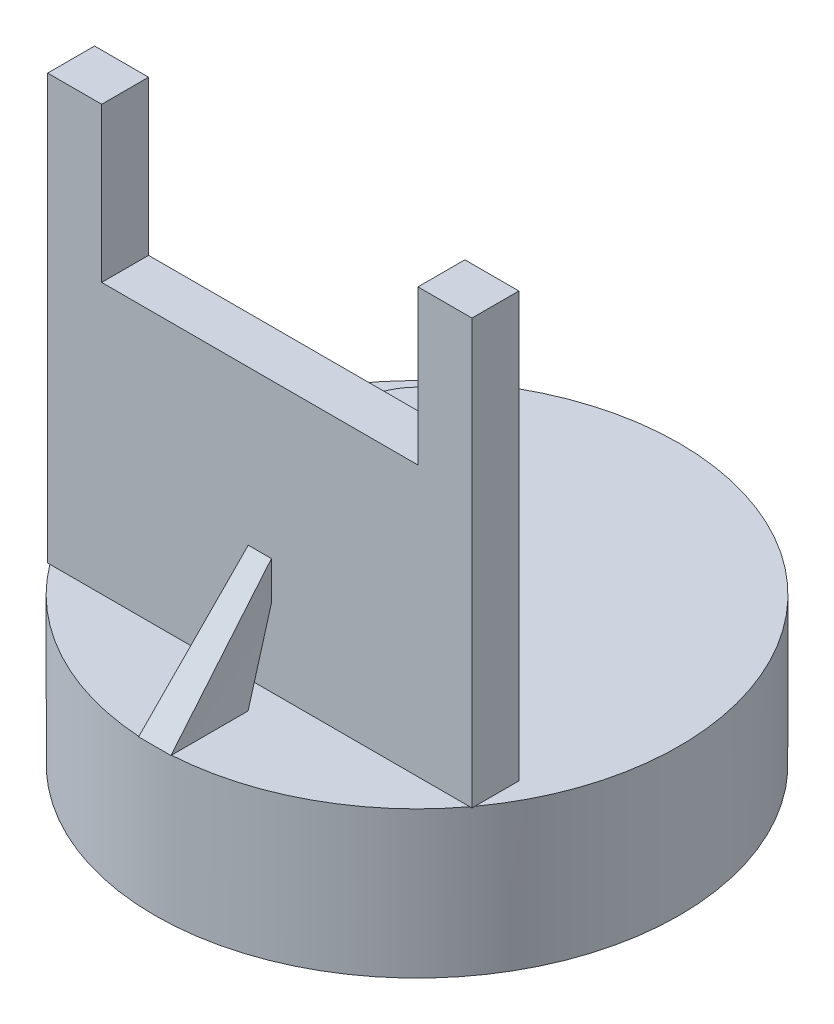
from build123d import *

# Parameters (mm, degrees)
SKETCH10_R              = 7.5
SKETCH10_R_2            = 4.5
BOSS_EXTRUDE2_DEPTH     = 8
CUT_EXTRUDE2_DEPTH      = 19
CUT_EXTRUDE2_DEPTH_BACK = 12
SKETCH11_W              = 4
SKETCH11_H              = 2
SKETCH13_R              = 7.5
SKETCH13_R_2            = 2.5
BOSS_EXTRUDE3_DEPTH     = 10
SKETCH15_W              = 55
SKETCH15_H              = 6.077899871
BOSS_EXTRUDE4_DEPTH     = 35
SKETCH16_W              = 7
SKETCH16_H              = 6.077899871
BOSS_EXTRUDE5_DEPTH     = 20


with BuildPart() as part:
    # Sketch2 → Revolve1 (revolve)
    with BuildSketch(Plane(origin=(0, 0, 0), x_dir=(0, 0, -1), z_dir=(1, 0, 0))):
        Polygon((31, 0), (31, -15), (34, -15), (34, 4), (31, 4), (4.5, 4), (4.5, 1), (28, 1), (28, 0), align=None)
    revolve(axis=Axis((0, 0, 0), (0, 1, 0)))

    # Sketch10 → Boss-Extrude2 (add)
    with BuildSketch(Plane(origin=(0, 4, 0), x_dir=(1, 0, 0), z_dir=(0, 1, 0))):
        with Locations(Location((0, 0, 0), (0, 0, 270))):
            Circle(SKETCH10_R)
        with Locations(Location((0, 0, 0), (0, 0, 90))):
            Circle(SKETCH10_R_2, mode=Mode.SUBTRACT)
    extrude(amount=BOSS_EXTRUDE2_DEPTH)

    # Sketch11 → Cut-Extrude2 (cut, two sides: drawn at the far end of the back side and taken through both)
    with BuildSketch(Plane(origin=(0, 0, 0), x_dir=(0, 0, -1), z_dir=(1, 0, 0)).offset(-CUT_EXTRUDE2_DEPTH_BACK)):
        with Locations((0, 11)):
            Rectangle(SKETCH11_W, SKETCH11_H)
    extrude(amount=CUT_EXTRUDE2_DEPTH + CUT_EXTRUDE2_DEPTH_BACK, mode=Mode.SUBTRACT)

    # Sketch13 → Boss-Extrude3 (add)
    with BuildSketch(Plane(origin=(0, 12, 0), x_dir=(1, 0, 0), z_dir=(0, 1, 0))):
        with Locations(Location((0, 0, 0), (0, 0, 270))):
            Circle(SKETCH13_R)
        with Locations(Location((0, 0, 0), (0, 0, 270))):
            Circle(SKETCH13_R_2, mode=Mode.SUBTRACT)
    extrude(amount=BOSS_EXTRUDE3_DEPTH)

    # Sketch15 → Boss-Extrude4 (add)
    with BuildSketch(Plane(origin=(0, 4, 0), x_dir=(1, 0, 0), z_dir=(0, 1, 0))):
        with Locations((0, -17.339890807)):
            Rectangle(SKETCH15_W, SKETCH15_H)
    extrude(amount=BOSS_EXTRUDE4_DEPTH)

    # Sketch16 → Boss-Extrude5 (add)
    with BuildSketch(Plane(origin=(0, 39, 0), x_dir=(1, 0, 0), z_dir=(0, 1, 0))):
        with Locations((24, -17.339890807)):
            Rectangle(SKETCH16_W, SKETCH16_H)
        with Locations((-24, -17.339890807)):
            Rectangle(SKETCH16_W, SKETCH16_H)
    extrude(amount=BOSS_EXTRUDE5_DEPTH)

    # Loft1: read off the stored shape, not the designer's step
    # Loft1: loft between two sections, ruled curve by curve
    loft1_from = [
        Edge.make_bspline([(-2.096925142, 4, 24), (-2.096925142, 4, 25.666666667), (-2.096925142, 4, 27.333333333), (-2.096925142, 4, 30.666666667), (-2.096925142, 4, 32.333333333), (-2.096925142, 4, 34)], [0, 0, 0, 0, 0.5, 0.5, 1, 1, 1, 1], 3),
        Edge.make_bspline([(2.096925142, 4, 34), (2.096925142, 4, 32.333333333), (2.096925142, 4, 30.666666667), (2.096925142, 4, 27.333333333), (2.096925142, 4, 25.666666667), (2.096925142, 4, 24)], [0, 0, 0, 0, 0.5, 0.5, 1, 1, 1, 1], 3),
        Edge.make_line((-2.096925142, 4, 24), (2.096925142, 4, 24)),
        Edge.make_line((2.096925142, 4, 34), (-2.096925142, 4, 34)),
    ]
    loft1_to = [
        Edge.make_bspline([(-1.5, 14, 20.378840742), (-1.5, 14.833333333, 20.378840742), (-1.5, 15.666666667, 20.378840742), (-1.5, 17.333333333, 20.378840742), (-1.5, 18.166666667, 20.378840742), (-1.5, 19, 20.378840742)], [0, 0, 0, 0, 0.5, 0.5, 1, 1, 1, 1], 3),
        Edge.make_bspline([(1.5, 19, 20.378840742), (1.5, 18.166666667, 20.378840742), (1.5, 17.333333333, 20.378840742), (1.5, 15.666666667, 20.378840742), (1.5, 14.833333333, 20.378840742), (1.5, 14, 20.378840742)], [0, 0, 0, 0, 0.5, 0.5, 1, 1, 1, 1], 3),
        Edge.make_line((-1.5, 14, 20.378840742), (1.5, 14, 20.378840742)),
        Edge.make_line((1.5, 19, 20.378840742), (-1.5, 19, 20.378840742)),
    ]
    loft1 = Solid(Shell([*[Face.make_surface_from_curves(loft1_from[k], loft1_to[k]) for k in range(4)], Face(Wire(loft1_from)), Face(Wire(loft1_to))]))
    add(loft1)


solid = part.part
